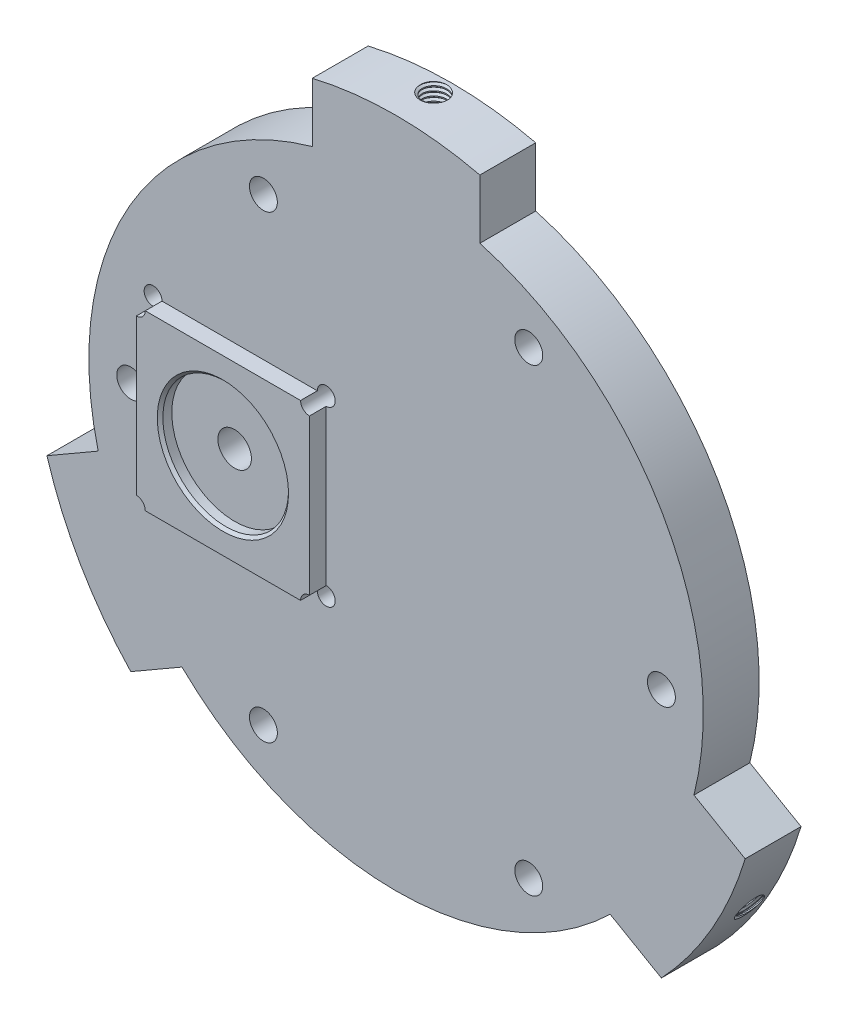
from build123d import *

# Parameters (mm, degrees)
SKIZZE1_R                       = 55
AUFSATZ_LINEAR_AUSTRAGEN1_DEPTH = 10
SKIZZE2_R                       = 3
SCHNITT_LINEAR_AUSTRAGEN1_DEPTH = 10
SKIZZE3_R                       = 2.5
SCHNITT_LINEAR_AUSTRAGEN2_DEPTH = 10
KREISMUSTER1_COUNT              = 6
SKIZZE4_W                       = 31
SKIZZE4_H                       = 31
AUFSATZ_LINEAR_AUSTRAGEN2_DEPTH = 3
SKIZZE5_R                       = 1.6
SCHNITT_LINEAR_AUSTRAGEN3_DEPTH = 30
SKIZZE6_R                       = 2.8
SCHNITT_LINEAR_AUSTRAGEN4_DEPTH = 2.2
SKIZZE7_R                       = 3
SCHNITT_LINEAR_AUSTRAGEN5_DEPTH = 5
SKIZZE8_R                       = 11.25
SCHNITT_LINEAR_AUSTRAGEN6_DEPTH = 2.1
FASE1_SIZE                      = 0.5
AUFSATZ_LINEAR_AUSTRAGEN3_DEPTH = 10
KREISMUSTER2_COUNT              = 3
SKIZZE10_R                      = 2.2
SCHNITT_LINEAR_AUSTRAGEN7_DEPTH = 17
KREISMUSTER3_COUNT              = 3
GEWINDE1_PITCH                  = 0.8
GEWINDE2_PITCH                  = 0.8
GEWINDE3_PITCH                  = 0.8


with BuildPart() as part:
    # Skizze1 → Aufsatz-Linear austragen1 (new body)
    with BuildSketch(Plane.XY):
        Circle(SKIZZE1_R)
    extrude(amount=AUFSATZ_LINEAR_AUSTRAGEN1_DEPTH)

    # Skizze2 → Schnitt-Linear austragen1 (cut)
    with BuildSketch(Plane.XY.offset(10)):
        with Locations((-28, 0)):
            Circle(SKIZZE2_R)
    extrude(amount=-SCHNITT_LINEAR_AUSTRAGEN1_DEPTH, mode=Mode.SUBTRACT)

    # Skizze3 → Schnitt-Linear austragen2 (cut)
    with BuildSketch(Plane.XY.offset(10)):
        with Locations((-47.5, 0)):
            Circle(SKIZZE3_R)
    schnitt_linear_austragen2 = extrude(amount=-SCHNITT_LINEAR_AUSTRAGEN2_DEPTH, mode=Mode.SUBTRACT)

    # Kreismuster1: Schnitt-Linear austragen2 ×6 about axis
    kreismuster1_axis = Axis((0, 0, 0), (0, 0, 1))
    for i in range(1, KREISMUSTER1_COUNT):
        add(schnitt_linear_austragen2.rotate(kreismuster1_axis, i * 360 / KREISMUSTER1_COUNT), mode=Mode.SUBTRACT)

    # Skizze4 → Aufsatz-Linear austragen2 (add)
    with BuildSketch(Plane.XY.offset(10)):
        with Locations((-28, 0)):
            Rectangle(SKIZZE4_W, SKIZZE4_H)
    extrude(amount=AUFSATZ_LINEAR_AUSTRAGEN2_DEPTH)

    # Skizze5 → Schnitt-Linear austragen3 (cut)
    with BuildSketch(Plane.XY.offset(13)):
        with Locations((-43.5, 15.5)):
            Circle(SKIZZE5_R)
        with Locations((-12.5, 15.5)):
            Circle(SKIZZE5_R)
        with Locations((-12.5, -15.5)):
            Circle(SKIZZE5_R)
        with Locations((-43.5, -15.5)):
            Circle(SKIZZE5_R)
    extrude(amount=-SCHNITT_LINEAR_AUSTRAGEN3_DEPTH, mode=Mode.SUBTRACT)

    # Skizze6 → Schnitt-Linear austragen4 (cut)
    with BuildSketch(Plane(origin=(0, 0, 0), x_dir=(-1, 0, 0), z_dir=(0, 0, -1))):
        with Locations((12.5, 15.5)):
            Circle(SKIZZE6_R)
        with Locations((12.5, -15.5)):
            Circle(SKIZZE6_R)
        with Locations((43.5, -15.5)):
            Circle(SKIZZE6_R)
        with Locations((43.5, 15.5)):
            Circle(SKIZZE6_R)
    extrude(amount=-SCHNITT_LINEAR_AUSTRAGEN4_DEPTH, mode=Mode.SUBTRACT)

    # Skizze7 → Schnitt-Linear austragen5 (cut)
    with BuildSketch(Plane.XY.offset(13)):
        with Locations((-28, 0)):
            Circle(SKIZZE7_R)
    extrude(amount=-SCHNITT_LINEAR_AUSTRAGEN5_DEPTH, mode=Mode.SUBTRACT)

    # Skizze8 → Schnitt-Linear austragen6 (cut)
    with BuildSketch(Plane.XY.offset(13)):
        with Locations((-28, 0)):
            Circle(SKIZZE8_R)
    extrude(amount=-SCHNITT_LINEAR_AUSTRAGEN6_DEPTH, mode=Mode.SUBTRACT)

    # Fase1
    fase1_edges = [part.edges().sort_by_distance(p)[0] for p in [
        (-39.25, 0, 13),
    ]]
    chamfer(fase1_edges, length=FASE1_SIZE)

    # Skizze9 → Aufsatz-Linear austragen3 (add)
    with BuildSketch(Plane.XY.offset(10)):
        with BuildLine():
            Line((-15, 63.502460582), (-15, 52.915026221))
            Line((-15, 52.915026221), (15, 52.915026221))
            Line((15, 52.915026221), (15, 63.502460582))
            ThreePointArc((15, 63.502460582), (0, 65.25), (-15, 63.502460582))
        make_face()
    aufsatz_linear_austragen3 = extrude(amount=-AUFSATZ_LINEAR_AUSTRAGEN3_DEPTH)

    # Kreismuster2: Aufsatz-Linear austragen3 ×3 about axis
    kreismuster2_axis = Axis((0, 0, 0), (0, 0, 1))
    for i in range(1, KREISMUSTER2_COUNT):
        add(aufsatz_linear_austragen3.rotate(kreismuster2_axis, i * 360 / KREISMUSTER2_COUNT))

    # Skizze10 → Schnitt-Linear austragen7 (cut)
    with BuildSketch(Plane(origin=(0, 70.5, 0), x_dir=(1, 0, 0), z_dir=(0, 1, 0))):
        with Locations(Location((0, -3, 0), (0, 0, 270))):
            Circle(SKIZZE10_R)
    schnitt_linear_austragen7 = extrude(amount=-SCHNITT_LINEAR_AUSTRAGEN7_DEPTH, mode=Mode.SUBTRACT)

    # Kreismuster3: Schnitt-Linear austragen7 ×3 about axis
    kreismuster3_axis = Axis((0, 0, 0), (0, 0, 1))
    for i in range(1, KREISMUSTER3_COUNT):
        add(schnitt_linear_austragen7.rotate(kreismuster3_axis, i * 360 / KREISMUSTER3_COUNT), mode=Mode.SUBTRACT)

    # Gewinde1: arcs per turn and ends read off the stored shape
    # Gewinde1: the profile of Gewindeprofil1 profile screwed along a right-hand helix through 21.25 turns, 8 arcs to a turn; built about Z, then put on its axis
    gewinde1_z = Axis((0, 0, 0), (0, 0, 1))
    gewinde1_corners = [(0, -2.1997, -17.000173205), (0, -2.6330127, -16.750000001), (0, -2.6330127, -16.650000001), (0, -2.1997, -16.399826797)]
    with BuildLine(mode=Mode.PRIVATE) as gewinde1_profile:
        Line(gewinde1_corners[0], gewinde1_corners[1])
        Line(gewinde1_corners[1], gewinde1_corners[2])
        Line(gewinde1_corners[2], gewinde1_corners[3])
        Line(gewinde1_corners[3], gewinde1_corners[0])
    gewinde1_cap = Face(gewinde1_profile.wire())
    gewinde1_turn_angles = [0, 22.5, 45, 67.5, 90, 112.5, 135, 157.5, 180, 202.5, 225, 247.5, 270, 292.5, 315, 337.5, 360]
    gewinde1_turn_weights = [1, 0.9238795325112867, 1, 0.9238795325112867, 1, 0.9238795325112867, 1, 0.9238795325112867, 1, 0.9238795325112867, 1, 0.9238795325112867, 1, 0.9238795325112867, 1, 0.9238795325112867, 1]
    gewinde1_turn_rails = [Edge.make_bspline([Vector(p[0], p[1], 0).rotate(gewinde1_z, gewinde1_turn_angles[k]) / gewinde1_turn_weights[k] + Vector(0, 0, p[2] + GEWINDE1_PITCH * gewinde1_turn_angles[k] / 360) for k in range(17)], [0, 0, 0, 1, 1, 2, 2, 3, 3, 4, 4, 5, 5, 6, 6, 7, 7, 8, 8, 8], 2, gewinde1_turn_weights) for p in gewinde1_corners]
    gewinde1_turn_sides = [Face.make_surface_from_curves(gewinde1_turn_rails[p[0]], gewinde1_turn_rails[p[1]]) for p in [(0, 1), (1, 2), (2, 3), (3, 0)]]
    gewinde1_last_angles = [7560, 7582.5, 7605, 7627.5, 7650]
    gewinde1_last_weights = [1, 0.9238795325112867, 1, 0.9238795325112867, 1]
    gewinde1_last_rails = [Edge.make_bspline([Vector(p[0], p[1], 0).rotate(gewinde1_z, gewinde1_last_angles[k]) / gewinde1_last_weights[k] + Vector(0, 0, p[2] + GEWINDE1_PITCH * gewinde1_last_angles[k] / 360) for k in range(5)], [0, 0, 0, 1, 1, 2, 2, 2], 2, gewinde1_last_weights) for p in gewinde1_corners]
    gewinde1_last_sides = [Face.make_surface_from_curves(gewinde1_last_rails[p[0]], gewinde1_last_rails[p[1]]) for p in [(0, 1), (1, 2), (2, 3), (3, 0)]]
    gewinde1 = Plane(origin=(0, 53.5, 3), x_dir=(-1, 0, 0), z_dir=(0, -1, 0)) * Solid(Shell([*[p.moved(Location((0, 0, GEWINDE1_PITCH * i))) for i in range(21) for p in gewinde1_turn_sides], *gewinde1_last_sides, gewinde1_cap, gewinde1_cap.rotate(gewinde1_z, 7650).moved(Location((0, 0, GEWINDE1_PITCH * 7650 / 360)))]))
    add(gewinde1, mode=Mode.SUBTRACT)

    # Gewinde2: arcs per turn and ends read off the stored shape
    # Gewinde2: the profile of Gewindeprofil2 profile screwed along a right-hand helix through 21.25 turns, 8 arcs to a turn; built about Z, then put on its axis
    gewinde2_z = Axis((0, 0, 0), (0, 0, 1))
    gewinde2_corners = [(0, -2.1997, -17.000173205), (0, -2.6330127, -16.750000001), (0, -2.6330127, -16.650000001), (0, -2.1997, -16.399826798)]
    with BuildLine(mode=Mode.PRIVATE) as gewinde2_profile:
        Line(gewinde2_corners[0], gewinde2_corners[1])
        Line(gewinde2_corners[1], gewinde2_corners[2])
        Line(gewinde2_corners[2], gewinde2_corners[3])
        Line(gewinde2_corners[3], gewinde2_corners[0])
    gewinde2_cap = Face(gewinde2_profile.wire())
    gewinde2_turn_angles = [0, 22.5, 45, 67.5, 90, 112.5, 135, 157.5, 180, 202.5, 225, 247.5, 270, 292.5, 315, 337.5, 360]
    gewinde2_turn_weights = [1, 0.9238795325112867, 1, 0.9238795325112867, 1, 0.9238795325112867, 1, 0.9238795325112867, 1, 0.9238795325112867, 1, 0.9238795325112867, 1, 0.9238795325112867, 1, 0.9238795325112867, 1]
    gewinde2_turn_rails = [Edge.make_bspline([Vector(p[0], p[1], 0).rotate(gewinde2_z, gewinde2_turn_angles[k]) / gewinde2_turn_weights[k] + Vector(0, 0, p[2] + GEWINDE2_PITCH * gewinde2_turn_angles[k] / 360) for k in range(17)], [0, 0, 0, 1, 1, 2, 2, 3, 3, 4, 4, 5, 5, 6, 6, 7, 7, 8, 8, 8], 2, gewinde2_turn_weights) for p in gewinde2_corners]
    gewinde2_turn_sides = [Face.make_surface_from_curves(gewinde2_turn_rails[p[0]], gewinde2_turn_rails[p[1]]) for p in [(0, 1), (1, 2), (2, 3), (3, 0)]]
    gewinde2_last_angles = [7560, 7582.5, 7605, 7627.5, 7650]
    gewinde2_last_weights = [1, 0.9238795325112867, 1, 0.9238795325112867, 1]
    gewinde2_last_rails = [Edge.make_bspline([Vector(p[0], p[1], 0).rotate(gewinde2_z, gewinde2_last_angles[k]) / gewinde2_last_weights[k] + Vector(0, 0, p[2] + GEWINDE2_PITCH * gewinde2_last_angles[k] / 360) for k in range(5)], [0, 0, 0, 1, 1, 2, 2, 2], 2, gewinde2_last_weights) for p in gewinde2_corners]
    gewinde2_last_sides = [Face.make_surface_from_curves(gewinde2_last_rails[p[0]], gewinde2_last_rails[p[1]]) for p in [(0, 1), (1, 2), (2, 3), (3, 0)]]
    gewinde2 = Plane(origin=(46.332359102, -26.75, 3), x_dir=(0, 0, 1), z_dir=(-0.866025404, 0.5, 0)) * Solid(Shell([*[p.moved(Location((0, 0, GEWINDE2_PITCH * i))) for i in range(21) for p in gewinde2_turn_sides], *gewinde2_last_sides, gewinde2_cap, gewinde2_cap.rotate(gewinde2_z, 7650).moved(Location((0, 0, GEWINDE2_PITCH * 7650 / 360)))]))
    add(gewinde2, mode=Mode.SUBTRACT)

    # Gewinde3: arcs per turn and ends read off the stored shape
    # Gewinde3: the profile of Gewindeprofil3 profile screwed along a right-hand helix through 21.25 turns, 8 arcs to a turn; built about Z, then put on its axis
    gewinde3_z = Axis((0, 0, 0), (0, 0, 1))
    gewinde3_corners = [(0, -2.1997, -17.000173205), (0, -2.6330127, -16.750000001), (0, -2.6330127, -16.650000001), (0, -2.1997, -16.399826798)]
    with BuildLine(mode=Mode.PRIVATE) as gewinde3_profile:
        Line(gewinde3_corners[0], gewinde3_corners[1])
        Line(gewinde3_corners[1], gewinde3_corners[2])
        Line(gewinde3_corners[2], gewinde3_corners[3])
        Line(gewinde3_corners[3], gewinde3_corners[0])
    gewinde3_cap = Face(gewinde3_profile.wire())
    gewinde3_turn_angles = [0, 22.5, 45, 67.5, 90, 112.5, 135, 157.5, 180, 202.5, 225, 247.5, 270, 292.5, 315, 337.5, 360]
    gewinde3_turn_weights = [1, 0.9238795325112867, 1, 0.9238795325112867, 1, 0.9238795325112867, 1, 0.9238795325112867, 1, 0.9238795325112867, 1, 0.9238795325112867, 1, 0.9238795325112867, 1, 0.9238795325112867, 1]
    gewinde3_turn_rails = [Edge.make_bspline([Vector(p[0], p[1], 0).rotate(gewinde3_z, gewinde3_turn_angles[k]) / gewinde3_turn_weights[k] + Vector(0, 0, p[2] + GEWINDE3_PITCH * gewinde3_turn_angles[k] / 360) for k in range(17)], [0, 0, 0, 1, 1, 2, 2, 3, 3, 4, 4, 5, 5, 6, 6, 7, 7, 8, 8, 8], 2, gewinde3_turn_weights) for p in gewinde3_corners]
    gewinde3_turn_sides = [Face.make_surface_from_curves(gewinde3_turn_rails[p[0]], gewinde3_turn_rails[p[1]]) for p in [(0, 1), (1, 2), (2, 3), (3, 0)]]
    gewinde3_last_angles = [7560, 7582.5, 7605, 7627.5, 7650]
    gewinde3_last_weights = [1, 0.9238795325112867, 1, 0.9238795325112867, 1]
    gewinde3_last_rails = [Edge.make_bspline([Vector(p[0], p[1], 0).rotate(gewinde3_z, gewinde3_last_angles[k]) / gewinde3_last_weights[k] + Vector(0, 0, p[2] + GEWINDE3_PITCH * gewinde3_last_angles[k] / 360) for k in range(5)], [0, 0, 0, 1, 1, 2, 2, 2], 2, gewinde3_last_weights) for p in gewinde3_corners]
    gewinde3_last_sides = [Face.make_surface_from_curves(gewinde3_last_rails[p[0]], gewinde3_last_rails[p[1]]) for p in [(0, 1), (1, 2), (2, 3), (3, 0)]]
    gewinde3 = Plane(origin=(-46.332359102, -26.75, 3), x_dir=(0, 0, -1), z_dir=(0.866025404, 0.5, 0)) * Solid(Shell([*[p.moved(Location((0, 0, GEWINDE3_PITCH * i))) for i in range(21) for p in gewinde3_turn_sides], *gewinde3_last_sides, gewinde3_cap, gewinde3_cap.rotate(gewinde3_z, 7650).moved(Location((0, 0, GEWINDE3_PITCH * 7650 / 360)))]))
    add(gewinde3, mode=Mode.SUBTRACT)


solid = part.part
